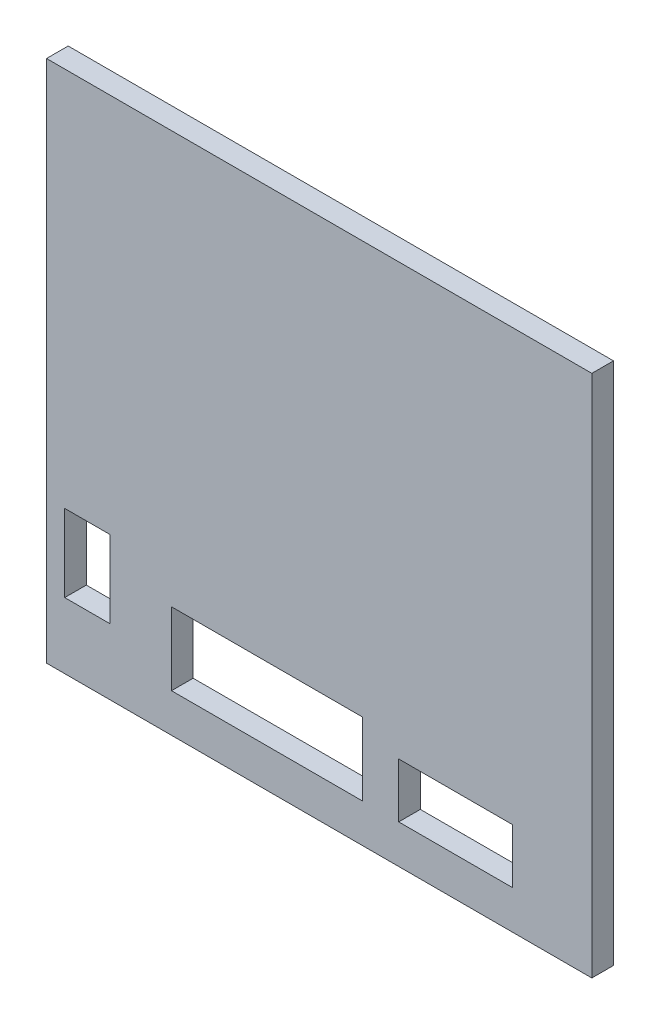
from build123d import *

# Parameters (mm, degrees)
SKETCH1_W           = 120
SKETCH1_H           = 115.2375
BOSS_EXTRUDE1_DEPTH = 4.7625
SKETCH2_W           = 25
SKETCH2_H           = 12
SKETCH2_W_2         = 42
SKETCH2_H_2         = 16
SKETCH2_W_3         = 10
SKETCH2_H_3         = 17
CUT_EXTRUDE1_DEPTH  = 84.32227648


with BuildPart() as part:
    # Sketch1 → Boss-Extrude1 (new body)
    with BuildSketch(Plane.XY):
        Rectangle(SKETCH1_W, SKETCH1_H)
    extrude(amount=-BOSS_EXTRUDE1_DEPTH)

    # Sketch2 → Cut-Extrude1 (cut, through all)
    with BuildSketch(Plane.XY):
        with Locations((30, -43.11875)):
            Rectangle(SKETCH2_W, SKETCH2_H)
        with Locations((-11.5, -41.11875)):
            Rectangle(SKETCH2_W_2, SKETCH2_H_2)
        with Locations((-51, -34.61875)):
            Rectangle(SKETCH2_W_3, SKETCH2_H_3)
    extrude(amount=-CUT_EXTRUDE1_DEPTH, mode=Mode.SUBTRACT)


solid = part.part
